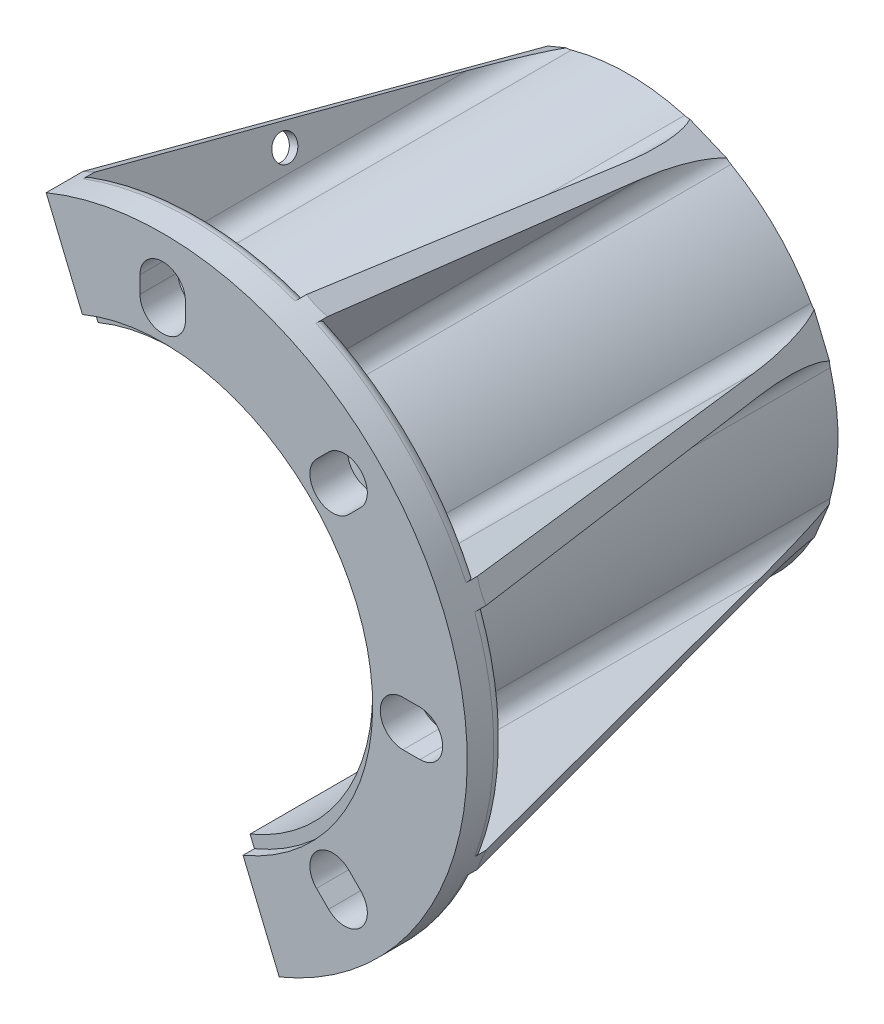
from build123d import *
from build123d.topology import SkipClean

# Parameters (mm, degrees)
SKETCH1_R               = 80.5
SKETCH1_R_2             = 55.5
BOSS_EXTRUDE1_DEPTH     = 10
BOSS_EXTRUDE2_START     = -120
SKETCH2_R               = 55.5
SKETCH2_R_2             = 52.5
BOSS_EXTRUDE2_DEPTH     = 120
BOSS_EXTRUDE3_START     = 113
BOSS_EXTRUDE3_DEPTH     = 113
SKETCH7_R               = 250
CUT_EXTRUDE1_DEPTH      = 211.239031532
CIRPATTERN1_COUNT       = 8
FILLET1_R               = 5
FILLET2_R               = 5
FILLET3_R               = 5
FILLET4_R               = 5
FILLET5_R               = 5
FILLET6_R               = 5
FILLET7_R               = 5
FILLET8_R               = 5
SKETCH10_R              = 3.25
CUT_EXTRUDE2_DEPTH      = 161.404177003
FILLET10_R              = 3
CUT_EXTRUDE3_DEPTH      = 161.404177103
CUT_EXTRUDE3_DEPTH_BACK = 161.404177103


with BuildPart() as part:
    # Sketch1 → Boss-Extrude1 (new body)
    with BuildSketch(Plane.XY):
        Circle(SKETCH1_R)
        with BuildLine():
            Line((-40.658639918, -49.143921292), (-43.840620434, -52.325901808))
            ThreePointArc((-43.840620434, -52.325901808), (-52.325901808, -52.325901808), (-52.325901808, -43.840620434))
            Line((-52.325901808, -43.840620434), (-49.143921292, -40.658639918))
            ThreePointArc((-49.143921292, -40.658639918), (-42.605180011, -39.35800341), (-38.901280605, -44.901280605))
            ThreePointArc((-38.901280605, -44.901280605), (-39.35800341, -47.1973812), (-40.658639918, -49.143921292))
        make_face(mode=Mode.SUBTRACT)
        Circle(SKETCH1_R_2, mode=Mode.SUBTRACT)
        with BuildLine():
            Line((6, -63.5), (6, -68))
            ThreePointArc((6, -68), (0, -74), (-6, -68))
            Line((-6, -68), (-6, -63.5))
            ThreePointArc((-6, -63.5), (0, -57.5), (6, -63.5))
        make_face(mode=Mode.SUBTRACT)
        with BuildLine():
            Line((49.143921292, -40.658639918), (52.325901808, -43.840620434))
            ThreePointArc((52.325901808, -43.840620434), (53.626538316, -45.787160526), (54.083261121, -48.083261121))
            ThreePointArc((54.083261121, -48.083261121), (50.379361715, -53.626538316), (43.840620434, -52.325901808))
            Line((43.840620434, -52.325901808), (40.658639918, -49.143921292))
            ThreePointArc((40.658639918, -49.143921292), (40.658639918, -40.658639918), (49.143921292, -40.658639918))
        make_face(mode=Mode.SUBTRACT)
        with BuildLine():
            Line((-63.5, -6), (-68, -6))
            ThreePointArc((-68, -6), (-74, 0), (-68, 6))
            Line((-68, 6), (-63.5, 6))
            ThreePointArc((-63.5, 6), (-59.257359313, 4.242640687), (-57.5, 0))
            ThreePointArc((-57.5, 0), (-59.257359313, -4.242640687), (-63.5, -6))
        make_face(mode=Mode.SUBTRACT)
        with BuildLine():
            Line((-49.143921292, 40.658639918), (-52.325901808, 43.840620434))
            ThreePointArc((-52.325901808, 43.840620434), (-52.325901808, 52.325901808), (-43.840620434, 52.325901808))
            Line((-43.840620434, 52.325901808), (-40.658639918, 49.143921292))
            ThreePointArc((-40.658639918, 49.143921292), (-39.35800341, 47.1973812), (-38.901280605, 44.901280605))
            ThreePointArc((-38.901280605, 44.901280605), (-42.605180011, 39.35800341), (-49.143921292, 40.658639918))
        make_face(mode=Mode.SUBTRACT)
        with BuildLine():
            Line((-6, 63.5), (-6, 68))
            ThreePointArc((-6, 68), (0, 74), (6, 68))
            Line((6, 68), (6, 63.5))
            ThreePointArc((6, 63.5), (0, 57.5), (-6, 63.5))
        make_face(mode=Mode.SUBTRACT)
        with BuildLine():
            Line((63.5, 6), (68, 6))
            ThreePointArc((68, 6), (72.242640687, 4.242640687), (74, 0))
            ThreePointArc((74, 0), (72.242640687, -4.242640687), (68, -6))
            Line((68, -6), (63.5, -6))
            ThreePointArc((63.5, -6), (57.5, 0), (63.5, 6))
        make_face(mode=Mode.SUBTRACT)
        with BuildLine():
            Line((40.658639918, 49.143921292), (43.840620434, 52.325901808))
            ThreePointArc((43.840620434, 52.325901808), (50.379361715, 53.626538316), (54.083261121, 48.083261121))
            ThreePointArc((54.083261121, 48.083261121), (53.626538316, 45.787160526), (52.325901808, 43.840620434))
            Line((52.325901808, 43.840620434), (49.143921292, 40.658639918))
            ThreePointArc((49.143921292, 40.658639918), (40.658639918, 40.658639918), (40.658639918, 49.143921292))
        make_face(mode=Mode.SUBTRACT)
    extrude(amount=BOSS_EXTRUDE1_DEPTH)

    # Sketch2 → Boss-Extrude2 (add)
    with BuildSketch(Plane.XY.offset(7).offset(BOSS_EXTRUDE2_START)):
        Circle(SKETCH2_R)
        Circle(SKETCH2_R_2, mode=Mode.SUBTRACT)
    extrude(amount=BOSS_EXTRUDE2_DEPTH)

    # Sketch6 → Boss-Extrude3 (add)
    with SkipClean():  # the faces are left unmerged after this step: merging them gives an invalid solid
        with BuildSketch(Plane(origin=(0, 0, 0), x_dir=(-1, 0, 0), z_dir=(0, 0, -1)).offset(BOSS_EXTRUDE3_START)):
            with BuildLine():
                ThreePointArc((33.556255229, 73.172588686), (30.806016305, 74.372302367), (28.012978034, 75.46868928))
                Line((28.012978034, 75.46868928), (19.313295414, 52.031208137))
                ThreePointArc((19.313295414, 52.031208137), (21.238930496, 51.275314054), (23.135057953, 50.448182262))
                Line((23.135057953, 50.448182262), (33.556255229, 73.172588686))
            make_face()
        boss_extrude3 = extrude(amount=-BOSS_EXTRUDE3_DEPTH)

    # Sketch7 → Cut-Extrude1 (cut, through all)
    with BuildSketch(Plane(origin=(-29.35002585, 70.857230463, -16.956202766), x_dir=(-0.9275655947526923, -0.3633903135082553, 0.08700314637676126), z_dir=(0.37366036168069705, -0.9020959128907735, 0.21587241151757414))):
        with Locations((-10.82464423, 97.787489685)):
            Circle(SKETCH7_R)
    cut_extrude1 = extrude(amount=-CUT_EXTRUDE1_DEPTH, mode=Mode.SUBTRACT)

    # CirPattern1: Boss-Extrude3, Cut-Extrude1 ×8 about axis
    with SkipClean():  # the faces are left unmerged after this step: merging them gives an invalid solid
        cirpattern1_axis = Axis((0, 0, 0), (0, 0, 1))
        add([boss_extrude3.rotate(cirpattern1_axis, i * 360 / CIRPATTERN1_COUNT) for i in range(1, CIRPATTERN1_COUNT)])
        add([cut_extrude1.rotate(cirpattern1_axis, i * 360 / CIRPATTERN1_COUNT) for i in range(1, CIRPATTERN1_COUNT)], mode=Mode.SUBTRACT)

    # Fillet1
    fillet1_edges = [part.edges().sort_by_distance(p)[0] for p in [
        (-19.313295414, -52.031208137, -56.5),
        (19.313295414, -52.031208137, -56.5),
    ]]
    fillet(fillet1_edges, radius=FILLET1_R)

    # Fillet2
    fillet2_edges = [part.edges().sort_by_distance(p)[0] for p in [
        (23.135057953, -50.448182262, -56.5),
        (50.448182262, -23.135057953, -56.5),
    ]]
    fillet(fillet2_edges, radius=FILLET2_R)

    # Fillet3
    fillet3_edges = [part.edges().sort_by_distance(p)[0] for p in [
        (52.031208137, -19.313295414, -56.5),
        (52.031208137, 19.313295414, -56.5),
    ]]
    fillet(fillet3_edges, radius=FILLET3_R)

    # Fillet4
    fillet4_edges = [part.edges().sort_by_distance(p)[0] for p in [
        (50.448182262, 23.135057953, -56.5),
        (23.135057953, 50.448182262, -56.5),
    ]]
    fillet(fillet4_edges, radius=FILLET4_R)

    # Fillet5
    fillet5_edges = [part.edges().sort_by_distance(p)[0] for p in [
        (-19.313295414, 52.031208137, -56.5),
        (19.313295414, 52.031208137, -56.5),
    ]]
    fillet(fillet5_edges, radius=FILLET5_R)

    # Fillet6
    fillet6_edges = [part.edges().sort_by_distance(p)[0] for p in [
        (-23.135057953, 50.448182262, -56.5),
        (-50.448182262, 23.135057953, -56.5),
    ]]
    fillet(fillet6_edges, radius=FILLET6_R)

    # Fillet7
    fillet7_edges = [part.edges().sort_by_distance(p)[0] for p in [
        (-52.031208137, 19.313295414, -56.5),
        (-52.031208137, -19.313295414, -56.5),
    ]]
    fillet(fillet7_edges, radius=FILLET7_R)

    # Fillet8
    fillet8_edges = [part.edges().sort_by_distance(p)[0] for p in [
        (-50.448182262, -23.135057953, -56.5),
        (-23.135057953, -50.448182262, -56.5),
    ]]
    fillet(fillet8_edges, radius=FILLET8_R)

    # Sketch10 → Cut-Extrude2 (cut, through all)
    with BuildSketch(Plane(origin=(0, 0, 0), x_dir=(0, 0, -1), z_dir=(0.93749924571842, 0.3479873047646907, 0))):
        with Locations(Location((45, 65.293034424, 0), (0, 0, 90))):
            Circle(SKETCH10_R)
    cut_extrude2 = extrude(amount=-CUT_EXTRUDE2_DEPTH, mode=Mode.SUBTRACT)

    # Mirror1: Cut-Extrude2 across plane
    add(cut_extrude2.mirror(Plane(origin=(0, 0, 0), x_dir=(0, 0, 1), z_dir=(-0.382683432365086, 0.9238795325112884, 0))), mode=Mode.SUBTRACT)

    # Fillet10
    # the kernel refuses this fillet: 3 mm, written as the material it takes off along each edge
    with BuildSketch(Plane(origin=(0, 0, 0), x_dir=(-0.33046803638275346, 0.9438171840612604, 0), z_dir=(0.9438171840612604, 0.33046803638275346, 0))) as fillet10_piece_1_section:
        with BuildLine():
            CenterArc((80.5 - FILLET10_R, FILLET10_R), FILLET10_R, 270, 90)
            Line((80.5 - FILLET10_R, 0), (80.5, 0))
            Line((80.5, 0), (80.5, FILLET10_R))
        make_face()
    fillet10_piece_1 = revolve(axis=Axis((0, 0, 0), (0, 0, 1)), revolution_arc=46.06707315, mode=Mode.PRIVATE)
    fillet10_piece_1 = split(fillet10_piece_1, bisect_by=Plane(origin=(-27.776847932, 74.832540233, 0.682281157), z_dir=(0.93749924571842, 0.34798730476469053, 0)), keep=Keep.TOP, mode=Mode.PRIVATE)
    add(fillet10_piece_1, mode=Mode.SUBTRACT)
    with BuildSketch(Plane(origin=(0, 0, 0), x_dir=(-0.41684789103882375, 0.9089762569707115, 0), z_dir=(0.9089762569707115, 0.41684789103882375, 0))) as fillet10_piece_2:
        with BuildLine():
            CenterArc((80.5 - FILLET10_R, FILLET10_R), FILLET10_R, 270, 90)
            Line((80.5 - FILLET10_R, 0), (80.5, 0))
            Line((80.5, 0), (80.5, FILLET10_R))
        make_face()
    revolve(axis=Axis((0, 0, 0), (0, 0, 1)), revolution_arc=40.728517997, mode=Mode.SUBTRACT)
    with BuildSketch(Plane(origin=(0, 0, 0), x_dir=(-0.41684789103882375, 0.9089762569707115, 0), z_dir=(0.9089762569707115, 0.41684789103882375, 0))) as fillet10_piece_3_section:
        with BuildLine():
            CenterArc((80.5 - FILLET10_R, FILLET10_R), FILLET10_R, 270, 90)
            Line((80.5 - FILLET10_R, 0), (80.5, 0))
            Line((80.5, 0), (80.5, FILLET10_R))
        make_face()
    fillet10_piece_3 = revolve(axis=Axis((0, 0, 0), (0, 0, 1)), revolution_arc=46.06707315, mode=Mode.PRIVATE)
    fillet10_piece_3 = split(fillet10_piece_3, bisect_by=Plane(origin=(-74.832540233, 27.776847932, 0.682281157), z_dir=(-0.34798730476469253, -0.9374992457184192, 0)), keep=Keep.TOP, mode=Mode.PRIVATE)
    add(fillet10_piece_3, mode=Mode.SUBTRACT)
    with BuildSketch(Plane(origin=(0, 0, 0), x_dir=(-0.9010557205417569, 0.4337033415584614, 0), z_dir=(0.4337033415584614, 0.9010557205417569, 0))) as fillet10_piece_4_section:
        with BuildLine():
            CenterArc((80.5 - FILLET10_R, FILLET10_R), FILLET10_R, 270, 90)
            Line((80.5 - FILLET10_R, 0), (80.5, 0))
            Line((80.5, 0), (80.5, FILLET10_R))
        make_face()
    fillet10_piece_4 = revolve(axis=Axis((0, 0, 0), (0, 0, 1)), revolution_arc=46.06707315, mode=Mode.PRIVATE)
    fillet10_piece_4 = split(fillet10_piece_4, bisect_by=Plane(origin=(-72.555793839, 33.273398961, 0.682281047), z_dir=(0.4168478910388258, 0.9089762569707106, 0)), keep=Keep.TOP, mode=Mode.PRIVATE)
    add(fillet10_piece_4, mode=Mode.SUBTRACT)
    with BuildSketch(Plane(origin=(0, 0, 0), x_dir=(-0.9374992457184192, 0.34798730476469253, 0), z_dir=(0.34798730476469253, 0.9374992457184192, 0))) as fillet10_piece_5:
        with BuildLine():
            CenterArc((80.5 - FILLET10_R, FILLET10_R), FILLET10_R, 270, 90)
            Line((80.5 - FILLET10_R, 0), (80.5, 0))
            Line((80.5, 0), (80.5, FILLET10_R))
        make_face()
    revolve(axis=Axis((0, 0, 0), (0, 0, 1)), revolution_arc=40.728517997, mode=Mode.SUBTRACT)
    with BuildSketch(Plane(origin=(0, 0, 0), x_dir=(-0.9374992457184192, 0.34798730476469253, 0), z_dir=(0.34798730476469253, 0.9374992457184192, 0))) as fillet10_piece_6_section:
        with BuildLine():
            CenterArc((80.5 - FILLET10_R, FILLET10_R), FILLET10_R, 270, 90)
            Line((80.5 - FILLET10_R, 0), (80.5, 0))
            Line((80.5, 0), (80.5, FILLET10_R))
        make_face()
    fillet10_piece_6 = revolve(axis=Axis((0, 0, 0), (0, 0, 1)), revolution_arc=46.06707315, mode=Mode.PRIVATE)
    fillet10_piece_6 = split(fillet10_piece_6, bisect_by=Plane(origin=(-72.555794184, -33.27339912, 0.682281157), z_dir=(0.41684789103882375, -0.9089762569707115, 0)), keep=Keep.TOP, mode=Mode.PRIVATE)
    add(fillet10_piece_6, mode=Mode.SUBTRACT)
    with BuildSketch(Plane(origin=(0, 0, 0), x_dir=(-0.9438171840612604, -0.3304680363827534, 0), z_dir=(-0.3304680363827534, 0.9438171840612604, 0))) as fillet10_piece_7_section:
        with BuildLine():
            CenterArc((80.5 - FILLET10_R, FILLET10_R), FILLET10_R, 270, 90)
            Line((80.5 - FILLET10_R, 0), (80.5, 0))
            Line((80.5, 0), (80.5, FILLET10_R))
        make_face()
    fillet10_piece_7 = revolve(axis=Axis((0, 0, 0), (0, 0, 1)), revolution_arc=46.06707315, mode=Mode.PRIVATE)
    fillet10_piece_7 = split(fillet10_piece_7, bisect_by=Plane(origin=(-74.832540233, -27.776847932, 0.682281157), z_dir=(-0.3479873047646904, 0.93749924571842, 0)), keep=Keep.TOP, mode=Mode.PRIVATE)
    add(fillet10_piece_7, mode=Mode.SUBTRACT)
    with BuildSketch(Plane(origin=(0, 0, 0), x_dir=(-0.9089762569707115, -0.41684789103882364, 0), z_dir=(-0.41684789103882364, 0.9089762569707115, 0))) as fillet10_piece_8:
        with BuildLine():
            CenterArc((80.5 - FILLET10_R, FILLET10_R), FILLET10_R, 270, 90)
            Line((80.5 - FILLET10_R, 0), (80.5, 0))
            Line((80.5, 0), (80.5, FILLET10_R))
        make_face()
    revolve(axis=Axis((0, 0, 0), (0, 0, 1)), revolution_arc=40.728517997, mode=Mode.SUBTRACT)
    with BuildSketch(Plane(origin=(0, 0, 0), x_dir=(-0.9089762569707115, -0.41684789103882364, 0), z_dir=(-0.41684789103882364, 0.9089762569707115, 0))) as fillet10_piece_9_section:
        with BuildLine():
            CenterArc((80.5 - FILLET10_R, FILLET10_R), FILLET10_R, 270, 90)
            Line((80.5 - FILLET10_R, 0), (80.5, 0))
            Line((80.5, 0), (80.5, FILLET10_R))
        make_face()
    fillet10_piece_9 = revolve(axis=Axis((0, 0, 0), (0, 0, 1)), revolution_arc=46.06707315, mode=Mode.PRIVATE)
    fillet10_piece_9 = split(fillet10_piece_9, bisect_by=Plane(origin=(-27.776847932, -74.832540233, 0.682281157), z_dir=(0.9374992457184192, -0.34798730476469253, 0)), keep=Keep.TOP, mode=Mode.PRIVATE)
    add(fillet10_piece_9, mode=Mode.SUBTRACT)
    with BuildSketch(Plane(origin=(0, 0, 0), x_dir=(-0.4337033415584623, -0.9010557205417564, 0), z_dir=(-0.9010557205417564, 0.4337033415584623, 0))) as fillet10_piece_10_section:
        with BuildLine():
            CenterArc((80.5 - FILLET10_R, FILLET10_R), FILLET10_R, 270, 90)
            Line((80.5 - FILLET10_R, 0), (80.5, 0))
            Line((80.5, 0), (80.5, FILLET10_R))
        make_face()
    fillet10_piece_10 = revolve(axis=Axis((0, 0, 0), (0, 0, 1)), revolution_arc=46.06707315, mode=Mode.PRIVATE)
    fillet10_piece_10 = split(fillet10_piece_10, bisect_by=Plane(origin=(-33.273398964, -72.555793844, 0.68228105), z_dir=(-0.9089762569707106, 0.4168478910388258, 0)), keep=Keep.TOP, mode=Mode.PRIVATE)
    add(fillet10_piece_10, mode=Mode.SUBTRACT)
    with BuildSketch(Plane(origin=(0, 0, 0), x_dir=(-0.34798730476469303, -0.9374992457184189, 0), z_dir=(-0.9374992457184189, 0.34798730476469303, 0))) as fillet10_piece_11:
        with BuildLine():
            CenterArc((80.5 - FILLET10_R, FILLET10_R), FILLET10_R, 270, 90)
            Line((80.5 - FILLET10_R, 0), (80.5, 0))
            Line((80.5, 0), (80.5, FILLET10_R))
        make_face()
    revolve(axis=Axis((0, 0, 0), (0, 0, 1)), revolution_arc=40.728517997, mode=Mode.SUBTRACT)
    with BuildSketch(Plane(origin=(0, 0, 0), x_dir=(-0.34798730476469303, -0.9374992457184189, 0), z_dir=(-0.9374992457184189, 0.34798730476469303, 0))) as fillet10_piece_12_section:
        with BuildLine():
            CenterArc((80.5 - FILLET10_R, FILLET10_R), FILLET10_R, 270, 90)
            Line((80.5 - FILLET10_R, 0), (80.5, 0))
            Line((80.5, 0), (80.5, FILLET10_R))
        make_face()
    fillet10_piece_12 = revolve(axis=Axis((0, 0, 0), (0, 0, 1)), revolution_arc=46.06707315, mode=Mode.PRIVATE)
    fillet10_piece_12 = split(fillet10_piece_12, bisect_by=Plane(origin=(33.27339912, -72.555794184, 0.682281157), z_dir=(0.9089762569707115, 0.41684789103882375, 0)), keep=Keep.TOP, mode=Mode.PRIVATE)
    add(fillet10_piece_12, mode=Mode.SUBTRACT)
    with BuildSketch(Plane(origin=(0, 0, 0), x_dir=(0.3304680363827525, -0.9438171840612608, 0), z_dir=(-0.9438171840612608, -0.3304680363827525, 0))) as fillet10_piece_13_section:
        with BuildLine():
            CenterArc((80.5 - FILLET10_R, FILLET10_R), FILLET10_R, 270, 90)
            Line((80.5 - FILLET10_R, 0), (80.5, 0))
            Line((80.5, 0), (80.5, FILLET10_R))
        make_face()
    fillet10_piece_13 = revolve(axis=Axis((0, 0, 0), (0, 0, 1)), revolution_arc=46.06707315, mode=Mode.PRIVATE)
    fillet10_piece_13 = split(fillet10_piece_13, bisect_by=Plane(origin=(27.776847932, -74.832540233, 0.682281157), z_dir=(-0.93749924571842, -0.3479873047646904, 0)), keep=Keep.TOP, mode=Mode.PRIVATE)
    add(fillet10_piece_13, mode=Mode.SUBTRACT)
    with BuildSketch(Plane(origin=(0, 0, 0), x_dir=(0.4168478910388232, -0.9089762569707117, 0), z_dir=(-0.9089762569707117, -0.4168478910388232, 0))) as fillet10_piece_14:
        with BuildLine():
            CenterArc((80.5 - FILLET10_R, FILLET10_R), FILLET10_R, 270, 90)
            Line((80.5 - FILLET10_R, 0), (80.5, 0))
            Line((80.5, 0), (80.5, FILLET10_R))
        make_face()
    revolve(axis=Axis((0, 0, 0), (0, 0, 1)), revolution_arc=40.728517997, mode=Mode.SUBTRACT)
    with BuildSketch(Plane(origin=(0, 0, 0), x_dir=(0.4168478910388232, -0.9089762569707117, 0), z_dir=(-0.9089762569707117, -0.4168478910388232, 0))) as fillet10_piece_15_section:
        with BuildLine():
            CenterArc((80.5 - FILLET10_R, FILLET10_R), FILLET10_R, 270, 90)
            Line((80.5 - FILLET10_R, 0), (80.5, 0))
            Line((80.5, 0), (80.5, FILLET10_R))
        make_face()
    fillet10_piece_15 = revolve(axis=Axis((0, 0, 0), (0, 0, 1)), revolution_arc=46.06707315, mode=Mode.PRIVATE)
    fillet10_piece_15 = split(fillet10_piece_15, bisect_by=Plane(origin=(74.832540233, -27.776847932, 0.682281157), z_dir=(0.34798730476469264, 0.9374992457184192, 0)), keep=Keep.TOP, mode=Mode.PRIVATE)
    add(fillet10_piece_15, mode=Mode.SUBTRACT)
    with BuildSketch(Plane(origin=(0, 0, 0), x_dir=(1, 0, 0), z_dir=(0, -1, 0))) as fillet10_piece_16:
        with BuildLine():
            CenterArc((80.5 - FILLET10_R, FILLET10_R), FILLET10_R, 270, 90)
            Line((80.5 - FILLET10_R, 0), (80.5, 0))
            Line((80.5, 0), (80.5, FILLET10_R))
        make_face()
    revolve(axis=Axis((0, 0, 0), (0, 0, 1)), revolution_arc=20.364258998, mode=Mode.SUBTRACT)
    with BuildSketch(Plane(origin=(0, 0, 0), x_dir=(1, 0, 0), z_dir=(0, -1, 0))) as fillet10_piece_17_section:
        with BuildLine():
            CenterArc((80.5 - FILLET10_R, FILLET10_R), FILLET10_R, 270, 90)
            Line((80.5 - FILLET10_R, 0), (80.5, 0))
            Line((80.5, 0), (80.5, FILLET10_R))
        make_face()
    fillet10_piece_17 = revolve(axis=Axis((0, 0, 0), (0, 0, 1)), revolution_arc=25.70248486, mode=Mode.PRIVATE)
    fillet10_piece_17 = split(fillet10_piece_17, bisect_by=Plane(origin=(72.555796773, 33.273400307, 0.682281157), z_dir=(-0.41684789103882364, 0.9089762569707116, 0)), keep=Keep.TOP, mode=Mode.PRIVATE)
    add(fillet10_piece_17, mode=Mode.SUBTRACT)
    with BuildSketch(Plane(origin=(0, 0, 0), x_dir=(0.9438171840612604, 0.3304680363827533, 0), z_dir=(0.3304680363827533, -0.9438171840612604, 0))) as fillet10_piece_18_section:
        with BuildLine():
            CenterArc((80.5 - FILLET10_R, FILLET10_R), FILLET10_R, 270, 90)
            Line((80.5 - FILLET10_R, 0), (80.5, 0))
            Line((80.5, 0), (80.5, FILLET10_R))
        make_face()
    fillet10_piece_18 = revolve(axis=Axis((0, 0, 0), (0, 0, 1)), revolution_arc=46.06707315, mode=Mode.PRIVATE)
    fillet10_piece_18 = split(fillet10_piece_18, bisect_by=Plane(origin=(74.832540233, 27.776847932, 0.682281157), z_dir=(0.3479873047646903, -0.9374992457184201, 0)), keep=Keep.TOP, mode=Mode.PRIVATE)
    add(fillet10_piece_18, mode=Mode.SUBTRACT)
    with BuildSketch(Plane(origin=(0, 0, 0), x_dir=(0.9089762569707115, 0.41684789103882364, 0), z_dir=(0.41684789103882364, -0.9089762569707115, 0))) as fillet10_piece_19:
        with BuildLine():
            CenterArc((80.5 - FILLET10_R, FILLET10_R), FILLET10_R, 270, 90)
            Line((80.5 - FILLET10_R, 0), (80.5, 0))
            Line((80.5, 0), (80.5, FILLET10_R))
        make_face()
    revolve(axis=Axis((0, 0, 0), (0, 0, 1)), revolution_arc=40.728517997, mode=Mode.SUBTRACT)
    with BuildSketch(Plane(origin=(0, 0, 0), x_dir=(0.9089762569707115, 0.41684789103882364, 0), z_dir=(0.41684789103882364, -0.9089762569707115, 0))) as fillet10_piece_20_section:
        with BuildLine():
            CenterArc((80.5 - FILLET10_R, FILLET10_R), FILLET10_R, 270, 90)
            Line((80.5 - FILLET10_R, 0), (80.5, 0))
            Line((80.5, 0), (80.5, FILLET10_R))
        make_face()
    fillet10_piece_20 = revolve(axis=Axis((0, 0, 0), (0, 0, 1)), revolution_arc=46.06707315, mode=Mode.PRIVATE)
    fillet10_piece_20 = split(fillet10_piece_20, bisect_by=Plane(origin=(27.776847932, 74.832540233, 0.682281157), z_dir=(-0.9374992457184192, 0.3479873047646927, 0)), keep=Keep.TOP, mode=Mode.PRIVATE)
    add(fillet10_piece_20, mode=Mode.SUBTRACT)
    with BuildSketch(Plane(origin=(0, 0, 0), x_dir=(0.4337033415584618, 0.9010557205417566, 0), z_dir=(0.9010557205417566, -0.4337033415584618, 0))) as fillet10_piece_21_section:
        with BuildLine():
            CenterArc((80.5 - FILLET10_R, FILLET10_R), FILLET10_R, 270, 90)
            Line((80.5 - FILLET10_R, 0), (80.5, 0))
            Line((80.5, 0), (80.5, FILLET10_R))
        make_face()
    fillet10_piece_21 = revolve(axis=Axis((0, 0, 0), (0, 0, 1)), revolution_arc=46.06707315, mode=Mode.PRIVATE)
    fillet10_piece_21 = split(fillet10_piece_21, bisect_by=Plane(origin=(33.27339912, 72.555794184, 0.682281157), z_dir=(0.9089762569707105, -0.41684789103882597, 0)), keep=Keep.TOP, mode=Mode.PRIVATE)
    add(fillet10_piece_21, mode=Mode.SUBTRACT)
    with BuildSketch(Plane(origin=(0, 0, 0), x_dir=(0.3479873047646927, 0.9374992457184191, 0), z_dir=(0.9374992457184191, -0.3479873047646927, 0))) as fillet10_piece_22:
        with BuildLine():
            CenterArc((80.5 - FILLET10_R, FILLET10_R), FILLET10_R, 270, 90)
            Line((80.5 - FILLET10_R, 0), (80.5, 0))
            Line((80.5, 0), (80.5, FILLET10_R))
        make_face()
    revolve(axis=Axis((0, 0, 0), (0, 0, 1)), revolution_arc=40.728517997, mode=Mode.SUBTRACT)
    with BuildSketch(Plane(origin=(0, 0, 0), x_dir=(0.3479873047646927, 0.9374992457184191, 0), z_dir=(0.9374992457184191, -0.3479873047646927, 0))) as fillet10_piece_23_section:
        with BuildLine():
            CenterArc((80.5 - FILLET10_R, FILLET10_R), FILLET10_R, 270, 90)
            Line((80.5 - FILLET10_R, 0), (80.5, 0))
            Line((80.5, 0), (80.5, FILLET10_R))
        make_face()
    fillet10_piece_23 = revolve(axis=Axis((0, 0, 0), (0, 0, 1)), revolution_arc=46.06707315, mode=Mode.PRIVATE)
    fillet10_piece_23 = split(fillet10_piece_23, bisect_by=Plane(origin=(-33.27339912, 72.555794184, 0.682281157), z_dir=(-0.9089762569707115, -0.41684789103882386, 0)), keep=Keep.TOP, mode=Mode.PRIVATE)
    add(fillet10_piece_23, mode=Mode.SUBTRACT)
    with BuildSketch(Plane(origin=(0, 0, 0), x_dir=(0.9010582131201076, -0.43369816297604785, 0), z_dir=(-0.43369816297604785, -0.9010582131201076, 0))) as fillet10_piece_24_section:
        with BuildLine():
            CenterArc((80.5 - FILLET10_R, FILLET10_R), FILLET10_R, 270, 90)
            Line((80.5 - FILLET10_R, 0), (80.5, 0))
            Line((80.5, 0), (80.5, FILLET10_R))
        make_face()
    fillet10_piece_24 = revolve(axis=Axis((0, 0, 0), (0, 0, 1)), revolution_arc=25.70248486, mode=Mode.PRIVATE)
    fillet10_piece_24 = split(fillet10_piece_24, bisect_by=Plane(origin=(72.555796773, -33.273400307, 0.682281157), z_dir=(-0.4168478910388259, -0.9089762569707107, 0)), keep=Keep.TOP, mode=Mode.PRIVATE)
    add(fillet10_piece_24, mode=Mode.SUBTRACT)
    with BuildSketch(Plane(origin=(0, 0, 0), x_dir=(0.9374992457184188, -0.3479873047646939, 0), z_dir=(-0.3479873047646939, -0.9374992457184188, 0))) as fillet10_piece_25:
        with BuildLine():
            CenterArc((80.5 - FILLET10_R, FILLET10_R), FILLET10_R, 270, 90)
            Line((80.5 - FILLET10_R, 0), (80.5, 0))
            Line((80.5, 0), (80.5, FILLET10_R))
        make_face()
    revolve(axis=Axis((0, 0, 0), (0, 0, 1)), revolution_arc=20.364258998, mode=Mode.SUBTRACT)

    # Sketch11 → Cut-Extrude3 (cut, two sides: drawn at the far end of the back side and taken through both)
    with BuildSketch(Plane(origin=(0, 0, 0), x_dir=(-1, 0, 0), z_dir=(0, 0, -1)).offset(-CUT_EXTRUDE3_DEPTH_BACK)):
        Polygon((0, 0), (45.922011884, 110.865543901), (156.787555785, 64.943532018), (64.943532018, -156.787555785), (-45.922011884, -110.865543901), align=None)
    extrude(amount=CUT_EXTRUDE3_DEPTH + CUT_EXTRUDE3_DEPTH_BACK, mode=Mode.SUBTRACT)


solid = part.part
